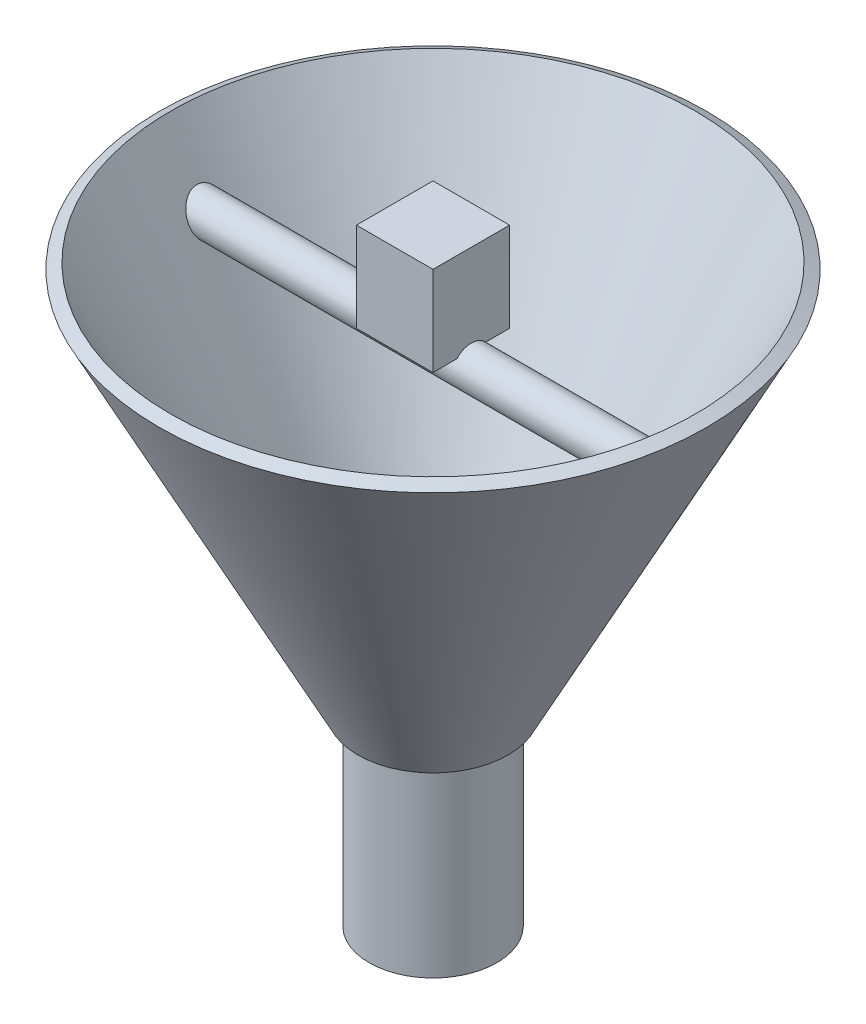
from build123d import *

# Parameters (mm, degrees)
BOSS_EXTRUDE1_REACH             = 44.655
SKETCH2_R                       = 1.5
BOSS_EXTRUDE1_DIRECTION_2_REACH = 44.655
BOSS_EXTRUDE2_DEPTH             = 3
BOSS_EXTRUDE2_DEPTH_BACK        = 3
SKETCH4_W                       = 6
SKETCH4_H                       = 7
BOSS_EXTRUDE3_START             = -15
BOSS_EXTRUDE3_OUTLINE_R         = 5
BOSS_EXTRUDE3_DEPTH             = 15
SKETCH5_R                       = 4.5
CUT_EXTRUDE1_DEPTH              = 15


# Read off the part's stored shape, not the designer's step: Boss-Extrude3
with BuildPart() as part:
    # Sketch1 → Revolve-Thin1 (revolve)
    with BuildSketch(Plane.XY, mode=Mode.PRIVATE) as revolve_thin1_sk:
        Polygon((5, 0), (20.553445617, 30), (21.441225663, 29.539732045), (5.887780046, -0.460267955), align=None)
    revolve(revolve_thin1_sk.sketch.rotate(Axis((0, 0, 0), (0, 1, 0)), 270), axis=Axis((0, 0, 0), (0, 1, 0)))

    # Boss-Extrude1: up to this cone (the profile starts inside it)
    boss_extrude1_end = Plane(origin=(0, 24.539732, 0), z_dir=(0, 1, 0)).offset(-34.183896267) * Cone(1e-06, 50.321346716, 97.061475837, align=(Align.CENTER, Align.CENTER, Align.MIN), mode=Mode.PRIVATE)
    # Sketch2 → Boss-Extrude1 (add, up to the surface)
    with BuildSketch(Plane(origin=(0, 0, 0), x_dir=(0, 0, -1), z_dir=(1, 0, 0)), mode=Mode.PRIVATE) as boss_extrude1_sk1:
        with Locations(Location((0, 24.539732045, 0), (0, 0, 319.809135036))):
            Circle(SKETCH2_R)
    boss_extrude1_tool1 = extrude(boss_extrude1_sk1.sketch, amount=BOSS_EXTRUDE1_REACH, mode=Mode.PRIVATE) & boss_extrude1_end
    add(boss_extrude1_tool1.solids().sort_by_distance((0, 24.539732, 0))[0])

    # Boss-Extrude1 direction 2: up to this cone (the profile starts inside it)
    boss_extrude1_direction_2_end = Plane(origin=(0, 24.539732, 0), z_dir=(0, 1, 0)).offset(-34.183896267) * Cone(1e-06, 50.321346716, 97.061475837, align=(Align.CENTER, Align.CENTER, Align.MIN), mode=Mode.PRIVATE)
    # Sketch2 → Boss-Extrude1 direction 2 (add, up to the surface)
    with BuildSketch(Plane(origin=(0, 0, 0), x_dir=(0, 0, -1), z_dir=(1, 0, 0)), mode=Mode.PRIVATE) as boss_extrude1_direction_2_sk1:
        with Locations(Location((0, 24.539732045, 0), (0, 0, 319.809135036))):
            Circle(SKETCH2_R)
    boss_extrude1_direction_2_tool1 = extrude(boss_extrude1_direction_2_sk1.sketch, amount=-BOSS_EXTRUDE1_DIRECTION_2_REACH, mode=Mode.PRIVATE) & boss_extrude1_direction_2_end
    add(boss_extrude1_direction_2_tool1.solids().sort_by_distance((0, 24.539732, 0))[0])


with BuildPart() as body_2:
    # Sketch4 → Boss-Extrude2 (new, two sides: drawn at the far end of the back side and taken through both)
    with BuildSketch(Plane(origin=(0, 0, 0), x_dir=(0, 0, -1), z_dir=(1, 0, 0)).offset(-BOSS_EXTRUDE2_DEPTH_BACK)):
        with Locations((0, 29.039732045)):
            Rectangle(SKETCH4_W, SKETCH4_H)
    extrude(amount=BOSS_EXTRUDE2_DEPTH + BOSS_EXTRUDE2_DEPTH_BACK)


with BuildPart() as body_3:
    # Boss-Extrude3 outline → Boss-Extrude3 (new body)
    with BuildSketch(Plane(origin=(0, 0, 0), x_dir=(1, 0, 0), z_dir=(0, 1, 0)).offset(BOSS_EXTRUDE3_START)):
        Circle(BOSS_EXTRUDE3_OUTLINE_R)
    extrude(amount=BOSS_EXTRUDE3_DEPTH)

    # Sketch5 → Cut-Extrude1 (cut)
    with BuildSketch(Plane.XZ.offset(15)):
        with Locations(Location((0, 0, 0), (0, 0, 270))):
            Circle(SKETCH5_R)
    extrude(amount=-CUT_EXTRUDE1_DEPTH, mode=Mode.SUBTRACT)


solid = Compound([part.part, body_2.part, body_3.part])
